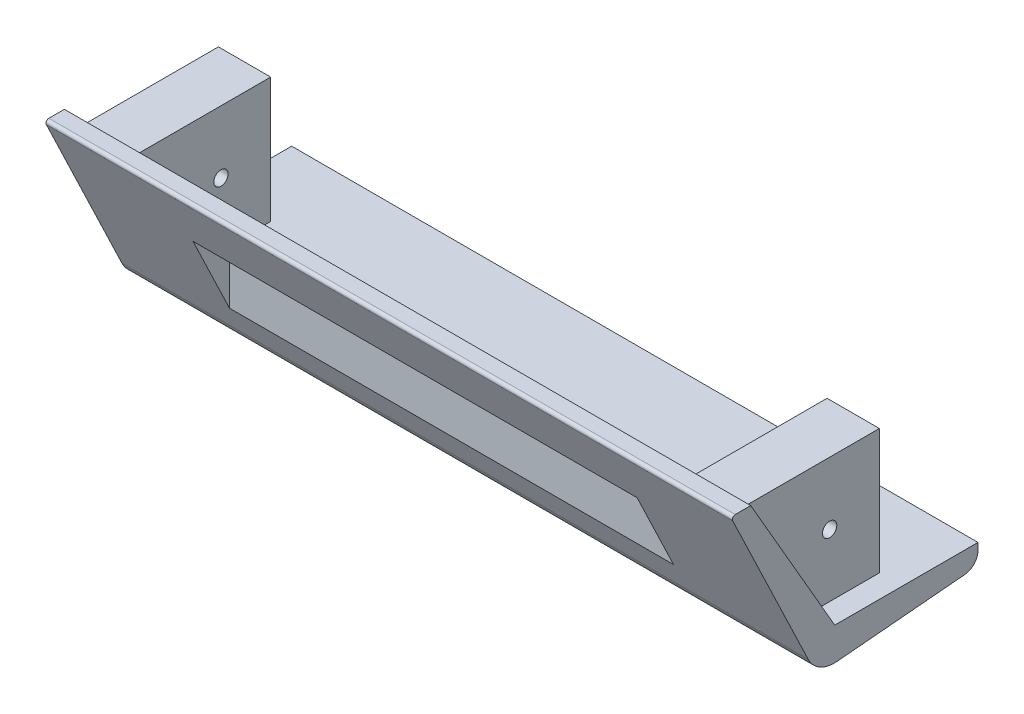
from build123d import *

# Parameters (mm, degrees)
BOSS_EXTRUDE2_DEPTH             = 119.775
BOSS_EXTRUDE1_REACH             = 141.38
SKETCH2_W                       = 18.25
SKETCH2_H                       = 43.65
BOSS_EXTRUDE1_DIRECTION_2_DEPTH = 20
CUT_EXTRUDE2_DEPTH              = 77.5
FILLET1_R                       = 10
FILLET2_R                       = 5
FILLET3_R                       = 1
TAP_DRILL_FOR_M6X1_0_TAP1_D     = 5
CUT_EXTRUDE3_DEPTH              = 10


with BuildPart() as part:
    # Sketch1 → Boss-Extrude2 (new, symmetric)
    with BuildSketch(Plane(origin=(0, 0, 0), x_dir=(0, 0, -1), z_dir=(1, 0, 0))):
        Polygon((0, 0), (-29.329393675, 50.8), (-36.329393675, 50.8), (-6.252899132, -12), (50, -7), (50, 0), align=None)
    extrude(amount=BOSS_EXTRUDE2_DEPTH, both=True)

    # Boss-Extrude1: up to this plane
    boss_extrude1_end = Plane(origin=(119.775, 0, 0), z_dir=(0, -0.5000000000000043, 0.8660254037844362))
    # Sketch2 → Boss-Extrude1 (add, up to the surface)
    with BuildSketch(Plane.XY, mode=Mode.PRIVATE) as boss_extrude1_sk1:
        with Locations((106.225, 25.4)):
            Rectangle(SKETCH2_W, SKETCH2_H)
    boss_extrude1_tool1 = split(extrude(boss_extrude1_sk1.sketch, amount=BOSS_EXTRUDE1_REACH, mode=Mode.PRIVATE), bisect_by=boss_extrude1_end, keep=Keep.BOTH, mode=Mode.PRIVATE)
    add(boss_extrude1_tool1.solids().sort_by_distance((106.225, 25.4, 0))[0])
    # Sketch2 → Boss-Extrude1 (add, up to the surface)
    with BuildSketch(Plane.XY, mode=Mode.PRIVATE) as boss_extrude1_sk2:
        with Locations((-106.225, 25.4)):
            Rectangle(SKETCH2_W, SKETCH2_H)
    boss_extrude1_tool2 = split(extrude(boss_extrude1_sk2.sketch, amount=BOSS_EXTRUDE1_REACH, mode=Mode.PRIVATE), bisect_by=boss_extrude1_end, keep=Keep.BOTH, mode=Mode.PRIVATE)
    add(boss_extrude1_tool2.solids().sort_by_distance((-106.225, 25.4, 0))[0])

    # Sketch2 → Boss-Extrude1 direction 2 (add)
    with BuildSketch(Plane.XY):
        with Locations((106.225, 25.4)):
            Rectangle(SKETCH2_W, SKETCH2_H)
        with Locations((-106.225, 25.4)):
            Rectangle(SKETCH2_W, SKETCH2_H)
    extrude(amount=-BOSS_EXTRUDE1_DIRECTION_2_DEPTH)

    # Sketch4 → Cut-Extrude2 (cut, symmetric)
    with BuildSketch(Plane(origin=(0, 0, 0), x_dir=(0, 0, -1), z_dir=(1, 0, 0))):
        Polygon((-26.729651832, 30.755649855), (-20, 34.641016151), (-14, 24.248711306), (-14, 4.176018579), align=None)
    extrude(amount=CUT_EXTRUDE2_DEPTH, both=True, mode=Mode.SUBTRACT)

    # Fillet1
    fillet1_edges = [part.edges().sort_by_distance(p)[0] for p in [
        (0, -12, 6.252899132),
    ]]
    fillet(fillet1_edges, radius=FILLET1_R)

    # Fillet2
    fillet2_edges = [part.edges().sort_by_distance(p)[0] for p in [
        (0, -7, -50),
    ]]
    fillet(fillet2_edges, radius=FILLET2_R)

    # Fillet3
    fillet3_edges = [part.edges().sort_by_distance(p)[0] for p in [
        (0, 50.8, 36.329393675),
    ]]
    fillet(fillet3_edges, radius=FILLET3_R)

    # Tap Drill for M6x1.0 Tap1 (through all)
    with Locations(Plane(origin=(115.35, 0, 0), x_dir=(0, 0, -1), z_dir=(1, 0, 0))):
        with Locations((2.640529151, 25.4)):
            Hole(TAP_DRILL_FOR_M6X1_0_TAP1_D / 2)

    # Sketch8 → Cut-Extrude3 (cut)
    with BuildSketch(Plane.ZY.offset(-77.5)):
        with BuildLine():
            Line((20, 34.641016151), (22.598076211, 33.141016151))
            Line((22.598076211, 33.141016151), (17.598076211, 24.480762114))
            ThreePointArc((17.598076211, 24.480762114), (16.383663494, 23.548910461), (14.866025404, 23.748711306))
            Line((14.866025404, 23.748711306), (14, 24.248711306))
            Line((14, 24.248711306), (20, 34.641016151))
        make_face()
    extrude(amount=-CUT_EXTRUDE3_DEPTH, mode=Mode.SUBTRACT)


solid = part.part
